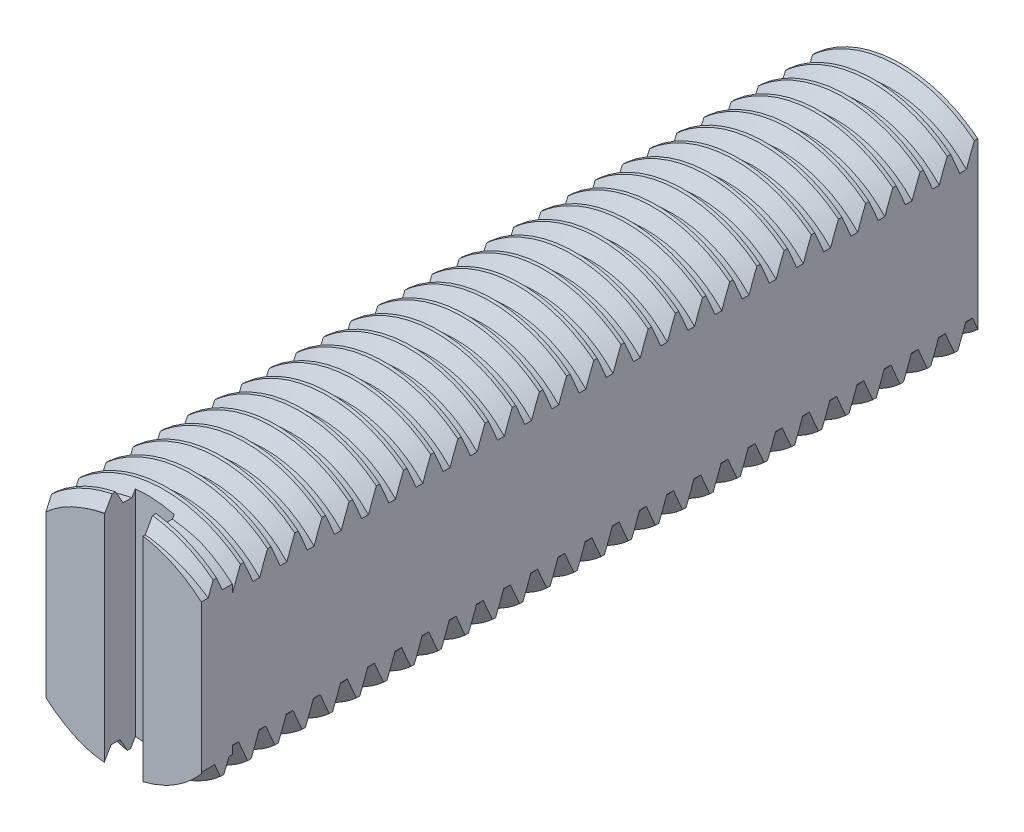
from build123d import *

# Parameters (mm, degrees)
SKETCH1_R           = 15
BOSS_EXTRUDE1_DEPTH = 100
THREAD1_PITCH       = 3.5
SKETCH4_W           = 5
SKETCH4_H           = 30
CUT_EXTRUDE1_DEPTH  = 100
BOSS_EXTRUDE2_DEPTH = 4
SKETCH6_W           = 5
SKETCH6_H           = 30
CUT_EXTRUDE3_DEPTH  = 4


with BuildPart() as part:
    # Sketch1 → Boss-Extrude1 (new body)
    with BuildSketch(Plane.XY):
        Circle(SKETCH1_R)
    extrude(amount=BOSS_EXTRUDE1_DEPTH)

    # Thread1: the profile of Thread Profile1 profile screwed along a right-hand helix of 31.428571 turns, 12 arcs to a turn; built about Z, then put on its axis
    thread1_z = Axis((0, 0, 0), (0, 0, 1))
    thread1_corners = [(15.0003, 0, -0.000173205), (15.0003, 0, 3.062673196), (13.105569437, 0, 1.968749995), (13.105569437, 0, 1.093749995)]
    with BuildLine(mode=Mode.PRIVATE) as thread1_profile:
        Line(thread1_corners[0], thread1_corners[1])
        Line(thread1_corners[1], thread1_corners[2])
        Line(thread1_corners[2], thread1_corners[3])
        Line(thread1_corners[3], thread1_corners[0])
    thread1_cap = Face(thread1_profile.wire())
    thread1_turn_angles = [0, 15, 30, 45, 60, 75, 90, 105, 120, 135, 150, 165, 180, 195, 210, 225, 240, 255, 270, 285, 300, 315, 330, 345, 360]
    thread1_turn_weights = [1, 0.9659258262890683, 1, 0.9659258262890683, 1, 0.9659258262890683, 1, 0.9659258262890683, 1, 0.9659258262890683, 1, 0.9659258262890683, 1, 0.9659258262890683, 1, 0.9659258262890683, 1, 0.9659258262890683, 1, 0.9659258262890683, 1, 0.9659258262890683, 1, 0.9659258262890683, 1]
    thread1_turn_rails = [Edge.make_bspline([Vector(p[0], p[1], 0).rotate(thread1_z, thread1_turn_angles[k]) / thread1_turn_weights[k] + Vector(0, 0, p[2] + THREAD1_PITCH * thread1_turn_angles[k] / 360) for k in range(25)], [0, 0, 0, 1, 1, 2, 2, 3, 3, 4, 4, 5, 5, 6, 6, 7, 7, 8, 8, 9, 9, 10, 10, 11, 11, 12, 12, 12], 2, thread1_turn_weights) for p in thread1_corners]
    thread1_turn_sides = [Face.make_surface_from_curves(thread1_turn_rails[p[0]], thread1_turn_rails[p[1]]) for p in [(0, 1), (1, 2), (2, 3), (3, 0)]]
    thread1_last_angles = [11160, 11175, 11190, 11205, 11220, 11235, 11250, 11265, 11280, 11295, 11310, 11312.142857143, 11314.285714286]
    thread1_last_weights = [1, 0.9659258262890683, 1, 0.9659258262890683, 1, 0.9659258262890683, 1, 0.9659258262890683, 1, 0.9659258262890683, 1, 0.9993007047883993, 1]
    thread1_last_rails = [Edge.make_bspline([Vector(p[0], p[1], 0).rotate(thread1_z, thread1_last_angles[k]) / thread1_last_weights[k] + Vector(0, 0, p[2] + THREAD1_PITCH * thread1_last_angles[k] / 360) for k in range(13)], [0, 0, 0, 1, 1, 2, 2, 3, 3, 4, 4, 5, 5, 6, 6, 6], 2, thread1_last_weights) for p in thread1_corners]
    thread1_last_sides = [Face.make_surface_from_curves(thread1_last_rails[p[0]], thread1_last_rails[p[1]]) for p in [(0, 1), (1, 2), (2, 3), (3, 0)]]
    thread1 = Plane(origin=(0, 0, -3.5), x_dir=(1, 0, 0), z_dir=(0, 0, 1)) * Solid(Shell([*[p.moved(Location((0, 0, THREAD1_PITCH * i))) for i in range(31) for p in thread1_turn_sides], *thread1_last_sides, thread1_cap, thread1_cap.rotate(thread1_z, 11314.285714286).moved(Location((0, 0, THREAD1_PITCH * 11314.285714286 / 360)))]))
    add(thread1, mode=Mode.SUBTRACT)

    # Sketch4 → Cut-Extrude1 (cut)
    with BuildSketch(Plane.XY.offset(100)):
        with Locations((12.5, 0)):
            Rectangle(SKETCH4_W, SKETCH4_H)
        with Locations((-12.5, 0)):
            Rectangle(SKETCH4_W, SKETCH4_H)
    extrude(amount=-CUT_EXTRUDE1_DEPTH, mode=Mode.SUBTRACT)

    # Sketch7 → Boss-Extrude2 (add)
    with BuildSketch(Plane.XY.offset(100)):
        with BuildLine():
            Line((-10, -9.5), (-10, 9.5))
            ThreePointArc((-10, 9.5), (0, 13.319660113), (10, 9.5))
            Line((10, 9.5), (10, -9.5))
            ThreePointArc((10, -9.5), (0, -13.319660113), (-10, -9.5))
        make_face()
    extrude(amount=-BOSS_EXTRUDE2_DEPTH)

    # Sketch6 → Cut-Extrude3 (cut)
    with BuildSketch(Plane.XY.offset(100)):
        Rectangle(SKETCH6_W, SKETCH6_H)
    extrude(amount=-CUT_EXTRUDE3_DEPTH, mode=Mode.SUBTRACT)


solid = part.part
